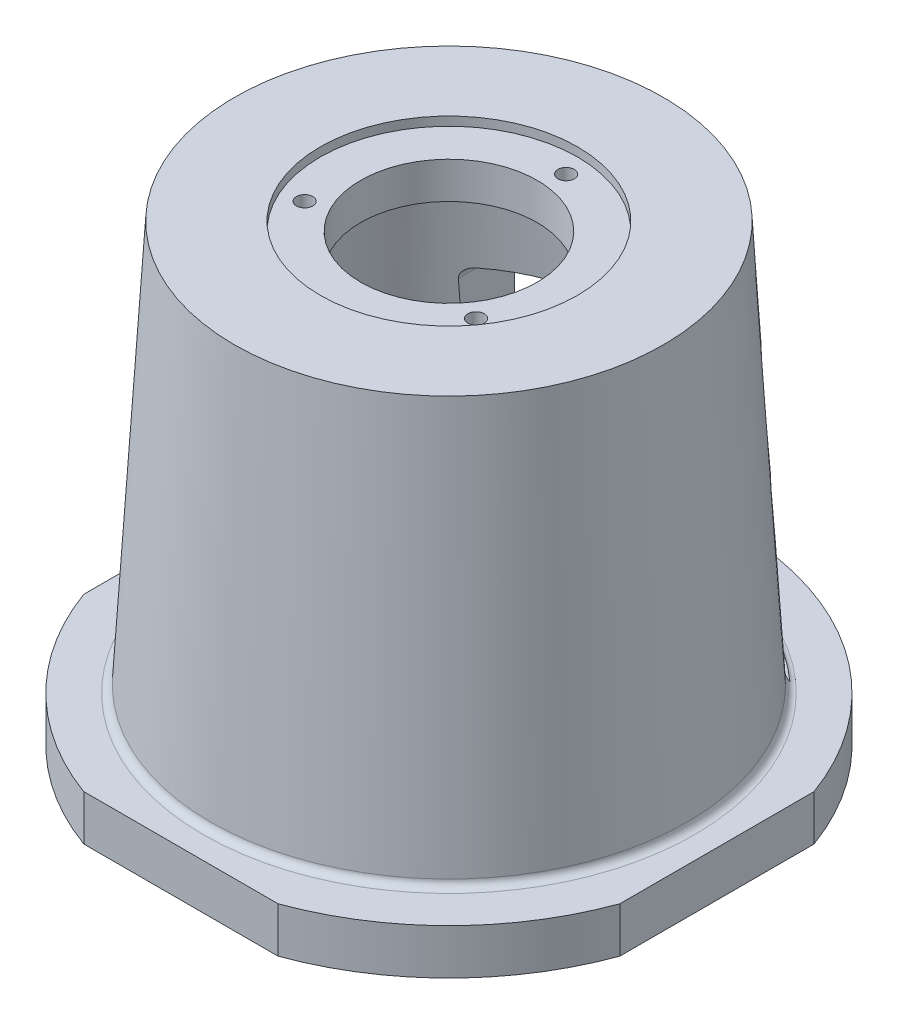
from build123d import *

# Parameters (mm, degrees)
CONG_1_R                     = 3
ESQUISSE2_W                  = 28.843575133
ESQUISSE2_H                  = 77
ESQUISSE2_W_2                = 77
ESQUISSE2_H_2                = 28.843575133
ENL_V_MAT_EXTRU_2_DEPTH      = 228.556586369
ENL_V_MAT_EXTRU_3_DEPTH      = 238.604187674
ENL_V_MAT_EXTRU_4_DEPTH      = 238.604187749
ENL_V_MAT_EXTRU_4_DEPTH_BACK = 238.604187749
ESQUISSE10_W                 = 22.430726153
ESQUISSE10_H                 = 145.5
PER_AGE1_START               = 162
PER_AGE1_OUTLINE_R           = 3.25
PER_AGE1_DEPTH               = 14.5
R_P_TITION_CIRCULAIRE1_COUNT = 3


# Read off the part's stored shape, not the designer's step: Perçage1
with BuildPart() as part:
    # Esquisse1 → Révolution1 (revolve)
    with BuildSketch(Plane.XY, mode=Mode.PRIVATE) as r_volution1_sk:
        Polygon((-113, 0), (-73, 0), (-63.470588237, 162), (0, 162), (0, 180), (-85, 180), (-94.529411763, 18), (-113, 18), align=None)
    revolve(r_volution1_sk.sketch.rotate(Axis((0, 193.73208918, 0), (0, -1, 0)), 270), axis=Axis((0, 193.73208918, 0), (0, -1, 0)))

    # Congé1
    cong_1_edges = [part.edges().sort_by_distance(p)[0] for p in [
        (0, 162, -63.470588237),
        (0, 18, -94.529411763),
    ]]
    fillet(cong_1_edges, radius=CONG_1_R)

    # Esquisse2 → Enlèv. mat.-Extru.2 (cut, through all)
    with BuildSketch(Plane(origin=(0, 18, 0), x_dir=(-1, 0, 0), z_dir=(0, 1, 0))):
        with Locations((120.660904657, 0)):
            Rectangle(ESQUISSE2_W, ESQUISSE2_H)
        with Locations((0, 120.660904657)):
            Rectangle(ESQUISSE2_W_2, ESQUISSE2_H_2)
        with Locations((-120.660904657, 0)):
            Rectangle(ESQUISSE2_W, ESQUISSE2_H)
    extrude(amount=-ENL_V_MAT_EXTRU_2_DEPTH, mode=Mode.SUBTRACT)

    # Esquisse5 → Enlèvement de matière-Révolution1 (revolve, cut)
    with BuildSketch(Plane.XY, mode=Mode.PRIVATE) as enl_vement_de_mati_re_r_volution1_sk:
        Polygon((-51, 180), (-51, 176.5), (-35, 176.5), (-35, 162), (0, 162), (0, 180), align=None)
    revolve(enl_vement_de_mati_re_r_volution1_sk.sketch.rotate(Axis((0, 197.596638655, 0), (0, -1, 0)), 90), axis=Axis((0, 197.596638655, 0), (0, -1, 0)), mode=Mode.SUBTRACT)

    # Esquisse9 → Enlèv. mat.-Extru.3 (cut, through all)
    with BuildSketch(Plane.XY):
        with BuildLine():
            Line((41, 117.5), (-41, 117.5))
            ThreePointArc((-41, 117.5), (-43.828427125, 116.328427125), (-45, 113.5))
            Line((-45, 113.5), (-45, 22.5))
            ThreePointArc((-45, 22.5), (-43.828427125, 19.671572875), (-41, 18.5))
            Line((-41, 18.5), (41, 18.5))
            ThreePointArc((41, 18.5), (43.828427125, 19.671572875), (45, 22.5))
            Line((45, 22.5), (45, 113.5))
            ThreePointArc((45, 113.5), (43.828427125, 116.328427125), (41, 117.5))
        make_face()
    extrude(amount=-ENL_V_MAT_EXTRU_3_DEPTH, mode=Mode.SUBTRACT)

    # Esquisse10 → Enlèv. mat.-Extru.4 (cut, two sides: drawn at the far end of the back side and taken through both)
    with BuildSketch(Plane(origin=(0, 0, 0), x_dir=(0, 0, -1), z_dir=(1, 0, 0)).offset(-ENL_V_MAT_EXTRU_4_DEPTH_BACK)):
        with Locations((82.215363077, 91.25)):
            Rectangle(ESQUISSE10_W, ESQUISSE10_H)
    extrude(amount=ENL_V_MAT_EXTRU_4_DEPTH + ENL_V_MAT_EXTRU_4_DEPTH_BACK, mode=Mode.SUBTRACT)

    # Perçage1 outline → Perçage1 (cut)
    with BuildSketch(Plane(origin=(0, 0, 0), x_dir=(1, 0, 0), z_dir=(0, 1, 0)).offset(PER_AGE1_START)):
        with Locations((35.304789832, -24.547338245)):
            Circle(PER_AGE1_OUTLINE_R)
    per_age1 = extrude(amount=PER_AGE1_DEPTH, mode=Mode.SUBTRACT)

    # Répétition circulaire1: Perçage1 ×3 about axis
    r_p_tition_circulaire1_axis = Axis((0, 0, 0), (0, 1, 0))
    for i in range(1, R_P_TITION_CIRCULAIRE1_COUNT):
        add(per_age1.rotate(r_p_tition_circulaire1_axis, i * 360 / R_P_TITION_CIRCULAIRE1_COUNT), mode=Mode.SUBTRACT)


solid = part.part
